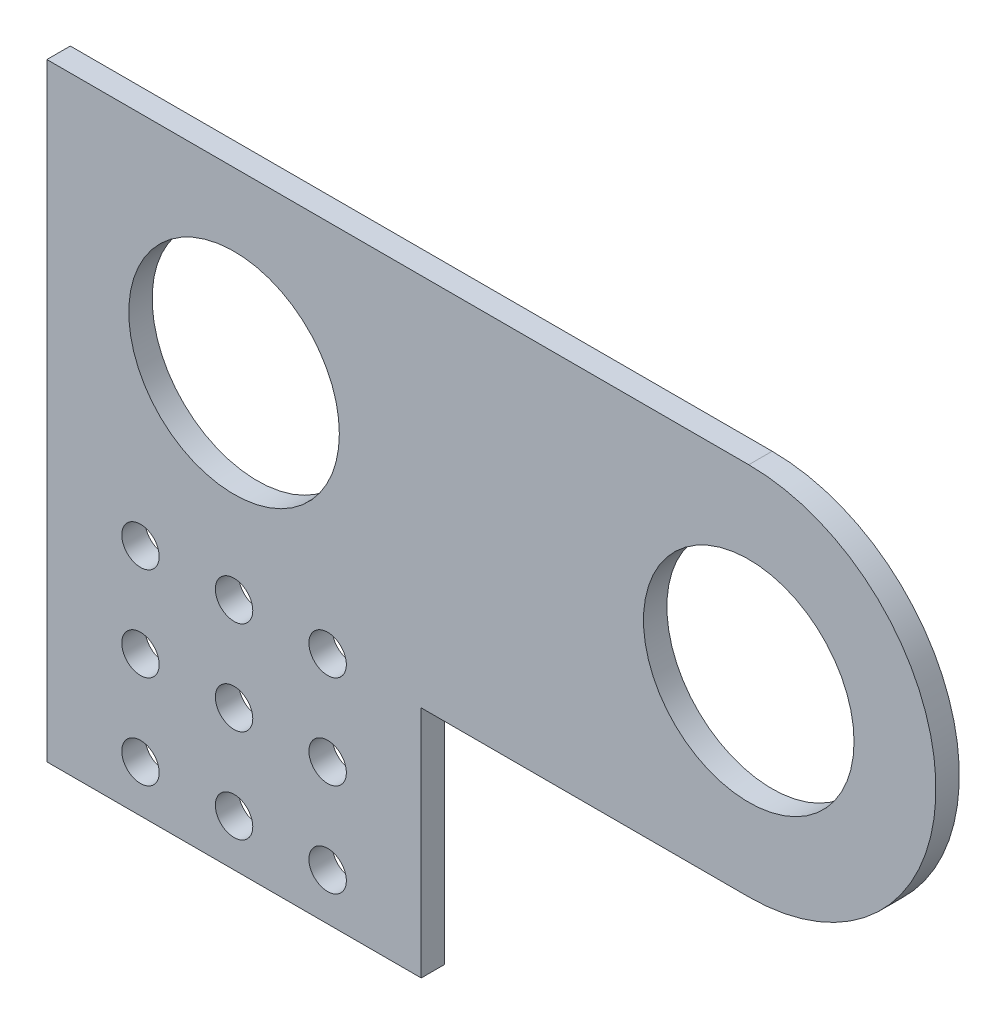
from build123d import *

# Parameters (mm, degrees)
SKETCH1_R           = 2.54
SKETCH1_R_2         = 14.2875
BOSS_EXTRUDE1_DEPTH = 3.175


with BuildPart() as part:
    # Sketch1 → Boss-Extrude1 (new body)
    with BuildSketch(Plane.XY):
        with BuildLine():
            Line((1.176784349, -201.485281466), (1.176784349, -150.685281466))
            Line((1.176784349, -150.685281466), (96.426784349, -150.685281466))
            ThreePointArc((96.426784349, -150.685281466), (121.826784349, -176.085281466), (96.426784349, -201.485281466))
            Line((96.426784349, -201.485281466), (51.976784349, -201.485281466))
            Line((51.976784349, -201.485281466), (51.976784349, -233.235281466))
            Line((51.976784349, -233.235281466), (1.176784349, -233.235281466))
            Line((1.176784349, -233.235281466), (1.176784349, -201.485281466))
        make_face()
        with Locations((13.876784349, -201.485281466)):
            Circle(SKETCH1_R, mode=Mode.SUBTRACT)
        with Locations((26.576784349, -201.485281466)):
            Circle(SKETCH1_R, mode=Mode.SUBTRACT)
        with Locations((39.276784349, -214.185281466)):
            Circle(SKETCH1_R, mode=Mode.SUBTRACT)
        with Locations((26.576784349, -214.185281466)):
            Circle(SKETCH1_R, mode=Mode.SUBTRACT)
        with Locations((39.276784349, -201.485281466)):
            Circle(SKETCH1_R, mode=Mode.SUBTRACT)
        with Locations((26.576784349, -226.885281466)):
            Circle(SKETCH1_R, mode=Mode.SUBTRACT)
        with Locations((39.276784349, -226.885281466)):
            Circle(SKETCH1_R, mode=Mode.SUBTRACT)
        with Locations((13.876784349, -214.185281466)):
            Circle(SKETCH1_R, mode=Mode.SUBTRACT)
        with Locations((13.876784349, -226.885281466)):
            Circle(SKETCH1_R, mode=Mode.SUBTRACT)
        with Locations((96.426784349, -176.085281466)):
            Circle(SKETCH1_R_2, mode=Mode.SUBTRACT)
        with Locations((26.576784349, -174.815281466)):
            Circle(SKETCH1_R_2, mode=Mode.SUBTRACT)
    extrude(amount=BOSS_EXTRUDE1_DEPTH)


solid = part.part
